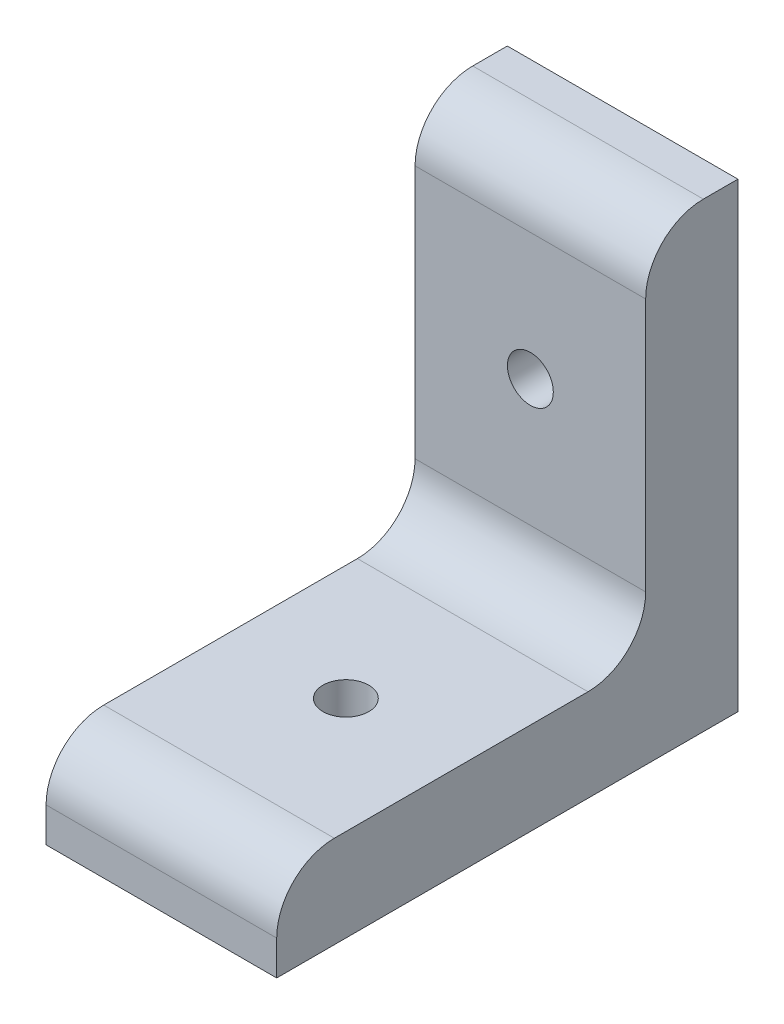
from build123d import *

# Parameters (mm, degrees)
BOSS_EXTRUDE1_DEPTH        = 25.4
FILLET1_R                  = 6.35
F_8_0_199_DIAMETER_HOLE1_D = 5.0546
F_8_0_199_DIAMETER_HOLE2_D = 5.0546


with BuildPart() as part:
    # Sketch1 → Boss-Extrude1 (new body)
    with BuildSketch(Plane(origin=(0, 0, 0), x_dir=(0, 0, -1), z_dir=(1, 0, 0))):
        Polygon((0, 0), (0, 50.8), (-10.16, 50.8), (-10.16, 10.16), (-50.8, 10.16), (-50.8, 0), align=None)
    extrude(amount=BOSS_EXTRUDE1_DEPTH)

    # Fillet1
    fillet1_edges = [part.edges().sort_by_distance(p)[0] for p in [
        (12.7, 50.8, 10.16),
        (12.7, 10.16, 50.8),
        (12.7, 10.16, 10.16),
    ]]
    fillet(fillet1_edges, radius=FILLET1_R)

    # #8 (0.199) Diameter Hole1 (through all)
    with Locations(Plane.XY.offset(10.16)):
        with Locations((12.7, 30.48)):
            Hole(F_8_0_199_DIAMETER_HOLE1_D / 2)

    # #8 (0.199) Diameter Hole2 (through all)
    with Locations(Plane(origin=(0, 10.16, 0), x_dir=(1, 0, 0), z_dir=(0, 1, 0))):
        with Locations((12.7, -30.48)):
            Hole(F_8_0_199_DIAMETER_HOLE2_D / 2)


solid = part.part
